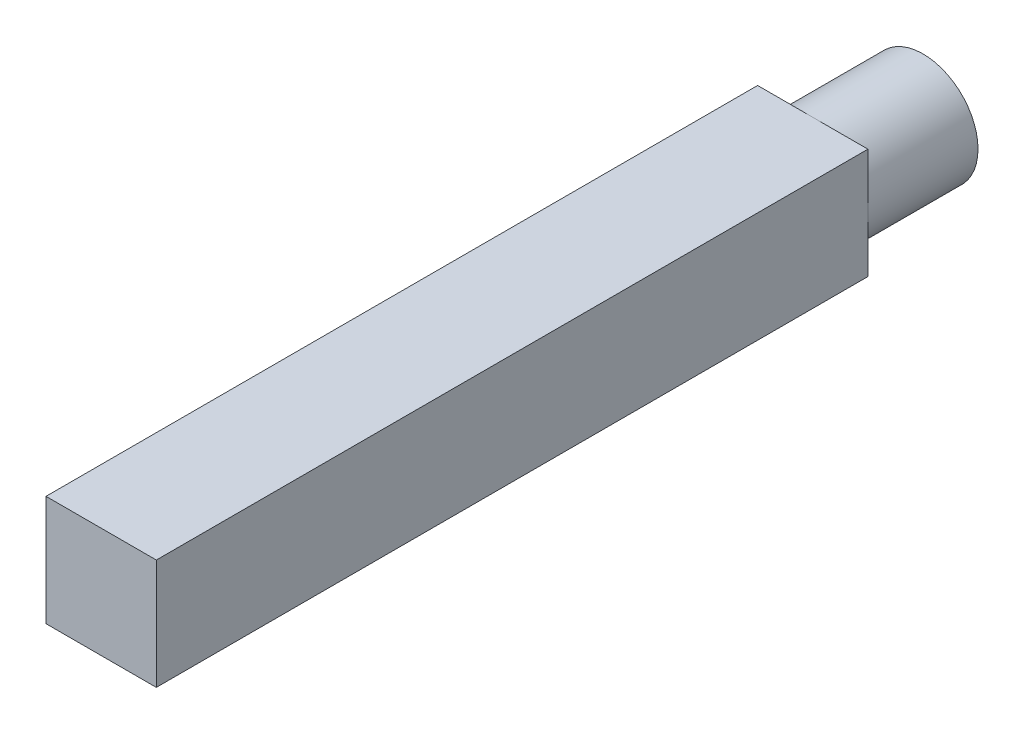
from build123d import *

# Parameters (mm, degrees)
SKETCH1_W           = 4
SKETCH1_H           = 4
BOSS_EXTRUDE1_DEPTH = 13.9
SKETCH2_R           = 1.99
BOSS_EXTRUDE2_DEPTH = 4
CUT_EXTRUDE1_REACH  = 20.45
SKETCH3_W           = 4
SKETCH3_H           = 6


with BuildPart() as part:
    # Sketch1 → Boss-Extrude1 (new, symmetric)
    with BuildSketch(Plane.XY):
        Rectangle(SKETCH1_W, SKETCH1_H)
    extrude(amount=BOSS_EXTRUDE1_DEPTH, both=True)

    # Sketch2 → Boss-Extrude2 (add)
    with BuildSketch(Plane.XY.offset(13.9)):
        Circle(SKETCH2_R)
    boss_extrude2 = extrude(amount=BOSS_EXTRUDE2_DEPTH)

    # Mirror2: Boss-Extrude2 across plane
    add(boss_extrude2.mirror(Plane.XY))

    # Sketch3 → Cut-Extrude1 (cut, up to next)
    with BuildSketch(Plane(origin=(0, 2, 0), x_dir=(1, 0, 0), z_dir=(0, 1, 0)), mode=Mode.PRIVATE) as cut_extrude1_sk1:
        with Locations((0, -14.9)):
            Rectangle(SKETCH3_W, SKETCH3_H)
    cut_extrude1_tool1 = extrude(cut_extrude1_sk1.sketch, amount=-CUT_EXTRUDE1_REACH, mode=Mode.PRIVATE) & part.part
    add(cut_extrude1_tool1.solids().sort_by_distance((0, 2, 14.9))[0], mode=Mode.SUBTRACT)


solid = part.part
